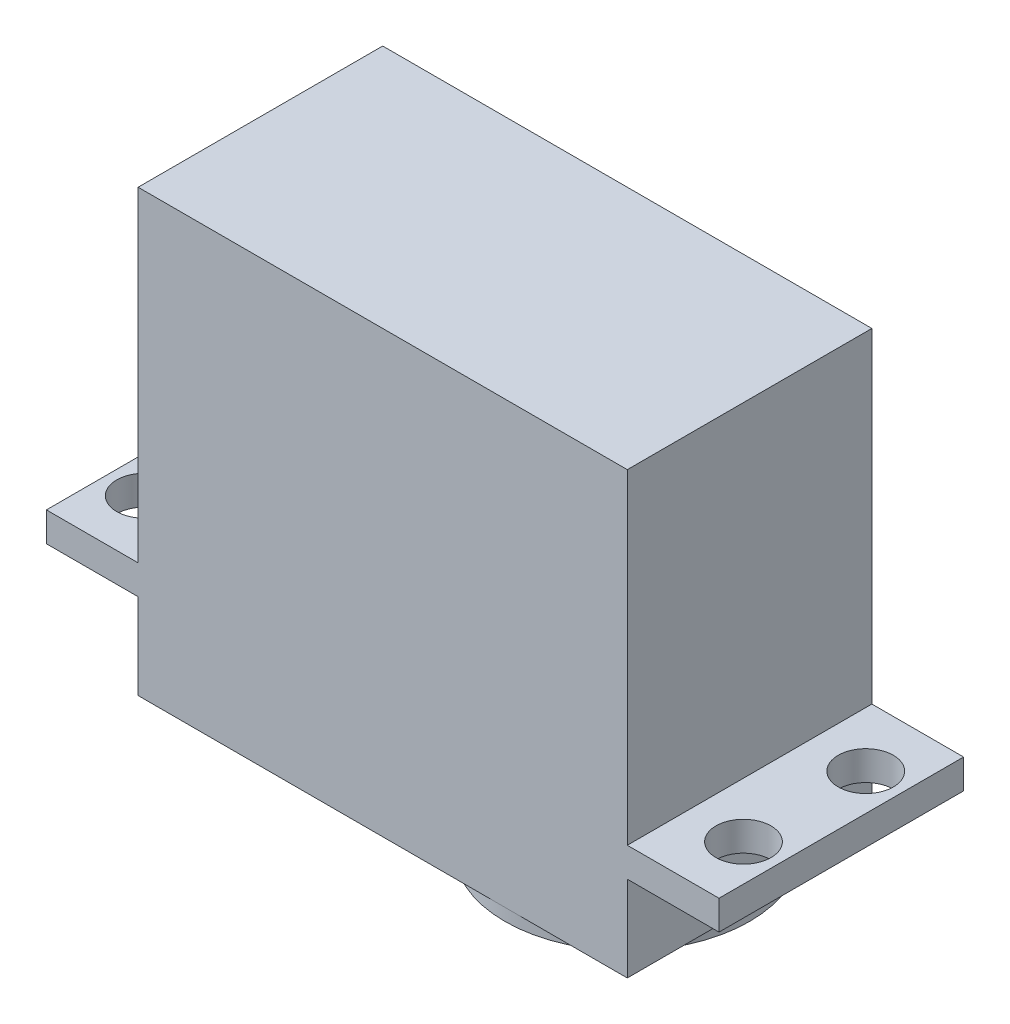
from build123d import *

# Parameters (mm, degrees)
SKETCH1_W            = 40
SKETCH1_H            = 20
BOSS_EXTRUDE1_DEPTH  = 36
SKETCH2_W            = 55
SKETCH2_H            = 20
BOSS_EXTRUDE2_DEPTH  = 2.4
M4_CLEARANCE_HOLE1_D = 4.5
SKETCH5_R            = 10
BOSS_EXTRUDE3_DEPTH  = 1


with BuildPart() as part:
    # Sketch1 → Boss-Extrude1 (new body)
    with BuildSketch(Plane(origin=(0, 0, 0), x_dir=(1, 0, 0), z_dir=(0, 1, 0))):
        Rectangle(SKETCH1_W, SKETCH1_H)
    extrude(amount=BOSS_EXTRUDE1_DEPTH)

    # Sketch2 → Boss-Extrude2 (add)
    with BuildSketch(Plane(origin=(0, 7, 0), x_dir=(1, 0, 0), z_dir=(0, 1, 0))):
        Rectangle(SKETCH2_W, SKETCH2_H)
    extrude(amount=BOSS_EXTRUDE2_DEPTH)

    # M4 Clearance Hole1 (through all)
    with Locations(Plane(origin=(0, 7, 0), x_dir=(-1, 0, 0), z_dir=(0, -1, 0))):
        with Locations((-24.5, 5), (-24.5, -5)):
            m4_clearance_hole1 = Hole(M4_CLEARANCE_HOLE1_D / 2)

    # Mirror1: M4 Clearance Hole1 across plane
    add(m4_clearance_hole1.mirror(Plane(origin=(0, 0, 0), x_dir=(0, 0, 1), z_dir=(1, 0, 0))), mode=Mode.SUBTRACT)

    # Sketch5 → Boss-Extrude3 (add)
    with BuildSketch(Plane.XZ):
        with Locations((10, 0)):
            Circle(SKETCH5_R)
    extrude(amount=BOSS_EXTRUDE3_DEPTH)


solid = part.part
